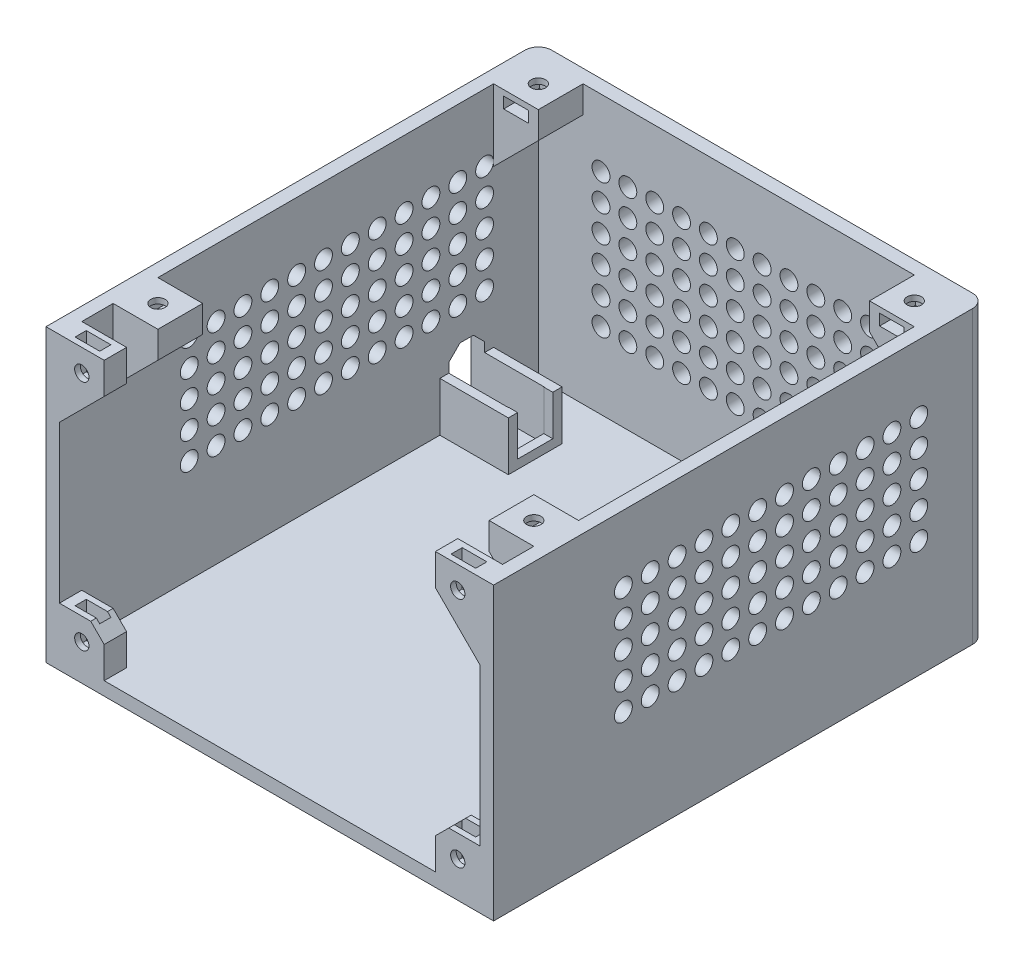
from build123d import *

# Parameters (mm, degrees)
SKETCH_2_W           = 100
SKETCH_2_H           = 65
EXTRUDE_1_DEPTH      = 110
SKETCH_3_W           = 94
SKETCH_3_H           = 107
CUT_EXTRUDE_1_DEPTH  = 62
SKETCH_4_W           = 10
SKETCH_4_H           = 10
SKETCH_4_R           = 1.6
EXTRUDE_2_DEPTH      = 5
SKETCH_5_W           = 10
SKETCH_5_H           = 10
SKETCH_5_R           = 1.6
EXTRUDE_3_DEPTH      = 5
SKETCH_6_W           = 5.5
SKETCH_6_H           = 2.5
CUT_EXTRUDE_2_DEPTH  = 8
SKETCH_8_W           = 5.5
SKETCH_8_H           = 2.5
CUT_EXTRUDE_3_DEPTH  = 8
CHAMFER_1_SIZE       = 3
CUT_EXTRUDE_5_REACH  = 154.172
EXTRUDE_5_DEPTH      = 11
SKETCH_16_W          = 5.817441426
SKETCH_16_H          = 7.857396668
CUT_EXTRUDE_6_DEPTH  = 9
SKETCH_31_W          = 10
SKETCH_31_H          = 6
EXTRUDE_10_DEPTH     = 10
EXTRUDE_10_2_DEPTH   = 10
EXTRUDE_14_DEPTH     = 10
EXTRUDE_16_DEPTH     = 10
SKETCH_32_R          = 1.6
CUT_EXTRUDE_15_DEPTH = 20
EXTRUDE_11_DEPTH     = 5
FILLET_8_R           = 3
FILLET_9_R           = 3
SKETCH_35_W          = 5.5
SKETCH_35_H          = 2.5
CUT_EXTRUDE_16_DEPTH = 8
SKETCH_36_W          = 10
SKETCH_36_H          = 6
EXTRUDE_12_DEPTH     = 10
SKETCH_37_W          = 10
SKETCH_37_H          = 6
EXTRUDE_13_DEPTH     = 10
EXTRUDE_15_DEPTH     = 10
EXTRUDE_17_DEPTH     = 10
SKETCH_38_R          = 1.6
CUT_EXTRUDE_17_DEPTH = 20
SKETCH_39_W          = 5.5
SKETCH_39_H          = 2.5
CUT_EXTRUDE_18_DEPTH = 8
SKETCH_46_R          = 2
CUT_EXTRUDE_31_DEPTH = 100
SKETCH_47_R          = 2
CUT_EXTRUDE_32_DEPTH = 6


with BuildPart() as part:
    # Эскиз2 → Бобышка-Вытянуть1 (new body)
    with BuildSketch(Plane.XY):
        Rectangle(SKETCH_2_W, SKETCH_2_H)
    extrude(amount=EXTRUDE_1_DEPTH)

    # Эскиз3 → Вырез-Вытянуть1 (cut)
    with BuildSketch(Plane(origin=(0, 32.5, 0), x_dir=(1, 0, 0), z_dir=(0, 1, 0))):
        with Locations((0, -56.5)):
            Rectangle(SKETCH_3_W, SKETCH_3_H)
    extrude(amount=-CUT_EXTRUDE_1_DEPTH, mode=Mode.SUBTRACT)

    # Эскиз4 → Бобышка-Вытянуть2 (add)
    # profile 1 of 2: a face of its own
    with BuildSketch(Plane.XY.offset(110)):
        with Locations((-42, -24.5)):
            Rectangle(SKETCH_4_W, SKETCH_4_H)
        with Locations((-42, -24.5)):
            Circle(SKETCH_4_R, mode=Mode.SUBTRACT)
    # profile 2 of 2: a face of its own
    with BuildSketch(Plane.XY.offset(110)):
        with Locations((42, -24.5)):
            Rectangle(SKETCH_4_W, SKETCH_4_H)
        with Locations((42, -24.5)):
            Circle(SKETCH_4_R, mode=Mode.SUBTRACT)
    extrude(amount=-EXTRUDE_2_DEPTH)

    # Эскиз5 → Бобышка-Вытянуть3 (add)
    # profile 1 of 2: a face of its own
    with BuildSketch(Plane.XY.offset(110)):
        with Locations((-42, 27.5)):
            Rectangle(SKETCH_5_W, SKETCH_5_H)
        with Locations((-42, 27.5)):
            Circle(SKETCH_5_R, mode=Mode.SUBTRACT)
    # profile 2 of 2: a face of its own
    with BuildSketch(Plane.XY.offset(110)):
        with Locations((42, 27.5)):
            Rectangle(SKETCH_5_W, SKETCH_5_H)
        with Locations((42, 27.5)):
            Circle(SKETCH_5_R, mode=Mode.SUBTRACT)
    extrude(amount=-EXTRUDE_3_DEPTH)

    # Эскиз6 → Вырез-Вытянуть2 (cut)
    with BuildSketch(Plane(origin=(0, 32.5, 0), x_dir=(1, 0, 0), z_dir=(0, 1, 0))):
        with Locations((-42, -107.5)):
            Rectangle(SKETCH_6_W, SKETCH_6_H)
        with Locations((42, -107.5)):
            Rectangle(SKETCH_6_W, SKETCH_6_H)
    extrude(amount=-CUT_EXTRUDE_2_DEPTH, mode=Mode.SUBTRACT)

    # Эскиз8 → Вырез-Вытянуть3 (cut)
    with BuildSketch(Plane(origin=(0, -19.5, 0), x_dir=(1, 0, 0), z_dir=(0, 1, 0))):
        with Locations((-42, -107.5)):
            Rectangle(SKETCH_8_W, SKETCH_8_H)
        with Locations((42, -107.5)):
            Rectangle(SKETCH_8_W, SKETCH_8_H)
    extrude(amount=-CUT_EXTRUDE_3_DEPTH, mode=Mode.SUBTRACT)

    # Фаска1
    # the kernel refuses this chamfer: 3 mm, written as the material it takes off along each edge
    with BuildSketch(Plane(origin=(-37, 22.5, 117.715048964), x_dir=(0.027495876610586733, 0.9996219169112968, 0), z_dir=(0, 0, -1)), Plane(origin=(-37, -19.5, 117.715048964), x_dir=(-0.9996219169112965, 0.02749587661058676, 0), z_dir=(0, 0, -1)), Plane(origin=(37, -19.5, 117.715048964), x_dir=(-0.027495876610586768, -0.9996219169112968, 0), z_dir=(0, 0, -1))) as chamfer_1_piece_1:
        Polygon((CHAMFER_1_SIZE * 0.999621916911, -CHAMFER_1_SIZE * 0.0274958766106), (-CHAMFER_1_SIZE * 0.0274958766106, -CHAMFER_1_SIZE * 0.999621916911), (0, 0), align=None)
    extrude(amount=20.430097928, mode=Mode.SUBTRACT)
    with BuildSketch(Plane(origin=(37, 22.5, 117.715048964), x_dir=(-0.027495876610586768, 0.9996219169112968, 0), z_dir=(0, 0, -1))) as chamfer_1_piece_2:
        Polygon((CHAMFER_1_SIZE * 0.999621916911, CHAMFER_1_SIZE * 0.0274958766106), (-CHAMFER_1_SIZE * 0.0274958766106, CHAMFER_1_SIZE * 0.999621916911), (0, 0), align=None)
    extrude(amount=20.430097928, mode=Mode.SUBTRACT)

    # Эскиз13 → Вырез-Вытянуть5 (cut, up to next)
    with BuildSketch(Plane.ZY.offset(50), mode=Mode.PRIVATE) as cut_extrude_5_sk1:
        Polygon((15, -29.5), (23, -29.5), (23, -16.4), (20.505788704, -13.9), (17.494211296, -13.9), (15, -16.4), align=None)
    cut_extrude_5_tool1 = extrude(cut_extrude_5_sk1.sketch, amount=-CUT_EXTRUDE_5_REACH, mode=Mode.PRIVATE) & part.part
    add(cut_extrude_5_tool1.solids().sort_by_distance((-50, -22.06639, 19))[0], mode=Mode.SUBTRACT)

    # Эскиз15 → Бобышка-Вытянуть5 (add)
    with BuildSketch(Plane(origin=(0, -29.5, 0), x_dir=(1, 0, 0), z_dir=(0, 1, 0))):
        Polygon((-47, -25), (-31.7, -25), (-31.7, -13), (-47, -13), (-47, -15), (-33.7, -15), (-33.7, -23), (-47, -23), align=None)
    extrude(amount=EXTRUDE_5_DEPTH)

    # Эскиз16 → Вырез-Вытянуть6 (cut)
    with BuildSketch(Plane(origin=(0, -18.5, 0), x_dir=(1, 0, 0), z_dir=(0, 1, 0))):
        with Locations((-31.7, -19)):
            Rectangle(SKETCH_16_W, SKETCH_16_H)
    extrude(amount=-CUT_EXTRUDE_6_DEPTH, mode=Mode.SUBTRACT)



with BuildPart() as body_2:
    # Эскиз31 → Бобышка-Вытянуть10 (new body)
    with BuildSketch(Plane.XY.offset(3)):
        with Locations((42, 29.5)):
            Rectangle(SKETCH_31_W, SKETCH_31_H)
    extrude(amount=EXTRUDE_10_DEPTH)


with BuildPart() as body_3:
    # Эскиз31 → Extrude 10 2 (new body)
    with BuildSketch(Plane.XY.offset(3)):
        with Locations((-42, 29.5)):
            Rectangle(SKETCH_31_W, SKETCH_31_H)
    extrude(amount=EXTRUDE_10_2_DEPTH)


with BuildPart() as part_1:
    add(part.part)

    add(body_2.part)  # Бобышка-Вытянуть14 merges body 2
    # Эскиз40 → Бобышка-Вытянуть14 (add)
    with BuildSketch(Plane.XY.offset(13)):
        Polygon((37, 26.5), (47, 26.5), (47, 16.5), align=None)
    extrude(amount=-EXTRUDE_14_DEPTH)


    add(body_3.part)  # Бобышка-Вытянуть16 merges body 3
    # Эскиз42 → Бобышка-Вытянуть16 (add)
    with BuildSketch(Plane.XY.offset(13)):
        Polygon((-37, 26.5), (-47, 26.5), (-47, 16.5), align=None)
    extrude(amount=-EXTRUDE_16_DEPTH)

    # Эскиз32 → Вырез-Вытянуть15 (cut)
    with BuildSketch(Plane(origin=(0, 32.5, 0), x_dir=(1, 0, 0), z_dir=(0, 1, 0))):
        with Locations(Location((-42, -8, 0), (0, 0, 270))):
            Circle(SKETCH_32_R)
        with Locations(Location((42, -8, 0), (0, 0, 270))):
            Circle(SKETCH_32_R)
    extrude(amount=-CUT_EXTRUDE_15_DEPTH, mode=Mode.SUBTRACT)

    # Эскиз34 → Бобышка-Вытянуть11 (add)
    with BuildSketch(Plane.XY.offset(110)):
        Polygon((-40, 22.5), (-47, 15.5), (-47, 22.5), align=None)
        Polygon((40, 22.5), (47, 22.5), (47, 15.5), align=None)
    extrude(amount=-EXTRUDE_11_DEPTH)

    # Скругление8
    fillet_8_edges = [part_1.edges().sort_by_distance(p)[0] for p in [
        (-50, 0, 0),
    ]]
    fillet(fillet_8_edges, radius=FILLET_8_R)

    # Скругление9
    fillet_9_edges = [part_1.edges().sort_by_distance(p)[0] for p in [
        (50, 0, 0),
    ]]
    fillet(fillet_9_edges, radius=FILLET_9_R)

    # Эскиз35 → Вырез-Вытянуть16 (cut)
    with BuildSketch(Plane.XY.offset(13)):
        with Locations((-42, 30)):
            Rectangle(SKETCH_35_W, SKETCH_35_H)
        with Locations((42, 30)):
            Rectangle(SKETCH_35_W, SKETCH_35_H)
    extrude(amount=-CUT_EXTRUDE_16_DEPTH, mode=Mode.SUBTRACT)

    # Эскиз36 → Бобышка-Вытянуть12 (add)
    with BuildSketch(Plane(origin=(-47, 0, 0), x_dir=(0, 0, -1), z_dir=(1, 0, 0))):
        with Locations((-93, 29.5)):
            Rectangle(SKETCH_36_W, SKETCH_36_H)
    extrude(amount=EXTRUDE_12_DEPTH)

    # Эскиз37 → Бобышка-Вытянуть13 (add)
    with BuildSketch(Plane.ZY.offset(-47)):
        with Locations((93, 29.5)):
            Rectangle(SKETCH_37_W, SKETCH_37_H)
    extrude(amount=EXTRUDE_13_DEPTH)

    # Эскиз41 → Бобышка-Вытянуть15 (add)
    with BuildSketch(Plane(origin=(0, 0, 88), x_dir=(-1, 0, 0), z_dir=(0, 0, -1))):
        Polygon((-47, 26.5), (-37, 26.5), (-47, 16.5), align=None)
    extrude(amount=-EXTRUDE_15_DEPTH)

    # Эскиз43 → Бобышка-Вытянуть17 (add)
    with BuildSketch(Plane(origin=(0, 0, 88), x_dir=(-1, 0, 0), z_dir=(0, 0, -1))):
        Polygon((37, 26.5), (47, 26.5), (47, 16.5), align=None)
    extrude(amount=-EXTRUDE_17_DEPTH)

    # Эскиз38 → Вырез-Вытянуть17 (cut)
    with BuildSketch(Plane(origin=(0, 32.5, 0), x_dir=(1, 0, 0), z_dir=(0, 1, 0))):
        with Locations(Location((-42, -93, 0), (0, 0, 270))):
            Circle(SKETCH_38_R)
        with Locations(Location((42, -93, 0), (0, 0, 270))):
            Circle(SKETCH_38_R)
    extrude(amount=-CUT_EXTRUDE_17_DEPTH, mode=Mode.SUBTRACT)

    # Эскиз39 → Вырез-Вытянуть18 (cut)
    with BuildSketch(Plane(origin=(0, 0, 88), x_dir=(-1, 0, 0), z_dir=(0, 0, -1))):
        with Locations((-42, 30)):
            Rectangle(SKETCH_39_W, SKETCH_39_H)
        with Locations((42, 30)):
            Rectangle(SKETCH_39_W, SKETCH_39_H)
    extrude(amount=-CUT_EXTRUDE_18_DEPTH, mode=Mode.SUBTRACT)

    # Эскиз46 → Вырез-Вытянуть31 (cut)
    with BuildSketch(Plane.ZY.offset(50)):
        with Locations(Location((15, 17.5, 0), (0, 0, 270))):
            Circle(SKETCH_46_R)
        with Locations(Location((21, 17.5, 0), (0, 0, 270))):
            Circle(SKETCH_46_R)
        with Locations(Location((27, 17.5, 0), (0, 0, 270))):
            Circle(SKETCH_46_R)
        with Locations(Location((33, 17.5, 0), (0, 0, 270))):
            Circle(SKETCH_46_R)
        with Locations(Location((39, 17.5, 0), (0, 0, 270))):
            Circle(SKETCH_46_R)
        with Locations(Location((45, 17.5, 0), (0, 0, 270))):
            Circle(SKETCH_46_R)
        with Locations(Location((51, 17.5, 0), (0, 0, 270))):
            Circle(SKETCH_46_R)
        with Locations(Location((57, 17.5, 0), (0, 0, 270))):
            Circle(SKETCH_46_R)
        with Locations(Location((63, 17.5, 0), (0, 0, 270))):
            Circle(SKETCH_46_R)
        with Locations(Location((69, 17.5, 0), (0, 0, 270))):
            Circle(SKETCH_46_R)
        with Locations(Location((75, 17.5, 0), (0, 0, 270))):
            Circle(SKETCH_46_R)
        with Locations(Location((81, 17.5, 0), (0, 0, 270))):
            Circle(SKETCH_46_R)
        with Locations(Location((21, 11.5, 0), (0, 0, 270))):
            Circle(SKETCH_46_R)
        with Locations(Location((27, 11.5, 0), (0, 0, 270))):
            Circle(SKETCH_46_R)
        with Locations(Location((33, 11.5, 0), (0, 0, 270))):
            Circle(SKETCH_46_R)
        with Locations(Location((39, 11.5, 0), (0, 0, 270))):
            Circle(SKETCH_46_R)
        with Locations(Location((45, 11.5, 0), (0, 0, 270))):
            Circle(SKETCH_46_R)
        with Locations(Location((51, 11.5, 0), (0, 0, 270))):
            Circle(SKETCH_46_R)
        with Locations(Location((57, 11.5, 0), (0, 0, 270))):
            Circle(SKETCH_46_R)
        with Locations(Location((63, 11.5, 0), (0, 0, 270))):
            Circle(SKETCH_46_R)
        with Locations(Location((69, 11.5, 0), (0, 0, 270))):
            Circle(SKETCH_46_R)
        with Locations(Location((75, 11.5, 0), (0, 0, 270))):
            Circle(SKETCH_46_R)
        with Locations(Location((81, 11.5, 0), (0, 0, 270))):
            Circle(SKETCH_46_R)
        with Locations(Location((15, 11.5, 0), (0, 0, 270))):
            Circle(SKETCH_46_R)
        with Locations(Location((15, 5.5, 0), (0, 0, 270))):
            Circle(SKETCH_46_R)
        with Locations(Location((21, 5.5, 0), (0, 0, 270))):
            Circle(SKETCH_46_R)
        with Locations(Location((27, 5.5, 0), (0, 0, 270))):
            Circle(SKETCH_46_R)
        with Locations(Location((33, 5.5, 0), (0, 0, 270))):
            Circle(SKETCH_46_R)
        with Locations(Location((39, 5.5, 0), (0, 0, 270))):
            Circle(SKETCH_46_R)
        with Locations(Location((45, 5.5, 0), (0, 0, 270))):
            Circle(SKETCH_46_R)
        with Locations(Location((51, 5.5, 0), (0, 0, 270))):
            Circle(SKETCH_46_R)
        with Locations(Location((57, 5.5, 0), (0, 0, 270))):
            Circle(SKETCH_46_R)
        with Locations(Location((63, 5.5, 0), (0, 0, 270))):
            Circle(SKETCH_46_R)
        with Locations(Location((69, 5.5, 0), (0, 0, 270))):
            Circle(SKETCH_46_R)
        with Locations(Location((75, 5.5, 0), (0, 0, 270))):
            Circle(SKETCH_46_R)
        with Locations(Location((81, 5.5, 0), (0, 0, 270))):
            Circle(SKETCH_46_R)
        with Locations(Location((15, -0.5, 0), (0, 0, 270))):
            Circle(SKETCH_46_R)
        with Locations(Location((21, -0.5, 0), (0, 0, 270))):
            Circle(SKETCH_46_R)
        with Locations(Location((27, -0.5, 0), (0, 0, 270))):
            Circle(SKETCH_46_R)
        with Locations(Location((33, -0.5, 0), (0, 0, 270))):
            Circle(SKETCH_46_R)
        with Locations(Location((39, -0.5, 0), (0, 0, 270))):
            Circle(SKETCH_46_R)
        with Locations(Location((45, -0.5, 0), (0, 0, 270))):
            Circle(SKETCH_46_R)
        with Locations(Location((51, -0.5, 0), (0, 0, 270))):
            Circle(SKETCH_46_R)
        with Locations(Location((57, -0.5, 0), (0, 0, 270))):
            Circle(SKETCH_46_R)
        with Locations(Location((63, -0.5, 0), (0, 0, 270))):
            Circle(SKETCH_46_R)
        with Locations(Location((69, -0.5, 0), (0, 0, 270))):
            Circle(SKETCH_46_R)
        with Locations(Location((75, -0.5, 0), (0, 0, 270))):
            Circle(SKETCH_46_R)
        with Locations(Location((81, -0.5, 0), (0, 0, 270))):
            Circle(SKETCH_46_R)
        with Locations(Location((15, -6.5, 0), (0, 0, 270))):
            Circle(SKETCH_46_R)
        with Locations(Location((21, -6.5, 0), (0, 0, 270))):
            Circle(SKETCH_46_R)
        with Locations(Location((27, -6.5, 0), (0, 0, 270))):
            Circle(SKETCH_46_R)
        with Locations(Location((33, -6.5, 0), (0, 0, 270))):
            Circle(SKETCH_46_R)
        with Locations(Location((39, -6.5, 0), (0, 0, 270))):
            Circle(SKETCH_46_R)
        with Locations(Location((45, -6.5, 0), (0, 0, 270))):
            Circle(SKETCH_46_R)
        with Locations(Location((51, -6.5, 0), (0, 0, 270))):
            Circle(SKETCH_46_R)
        with Locations(Location((57, -6.5, 0), (0, 0, 270))):
            Circle(SKETCH_46_R)
        with Locations(Location((63, -6.5, 0), (0, 0, 270))):
            Circle(SKETCH_46_R)
        with Locations(Location((69, -6.5, 0), (0, 0, 270))):
            Circle(SKETCH_46_R)
        with Locations(Location((75, -6.5, 0), (0, 0, 270))):
            Circle(SKETCH_46_R)
        with Locations(Location((81, -6.5, 0), (0, 0, 270))):
            Circle(SKETCH_46_R)
    extrude(amount=-CUT_EXTRUDE_31_DEPTH, mode=Mode.SUBTRACT)

    # Эскиз47 → Вырез-Вытянуть32 (cut)
    with BuildSketch(Plane(origin=(0, 0, 0), x_dir=(-1, 0, 0), z_dir=(0, 0, -1))):
        with Locations((-33, 17.5)):
            Circle(SKETCH_47_R)
        with Locations((-27, 17.5)):
            Circle(SKETCH_47_R)
        with Locations((-21, 17.5)):
            Circle(SKETCH_47_R)
        with Locations((-15, 17.5)):
            Circle(SKETCH_47_R)
        with Locations((-9, 17.5)):
            Circle(SKETCH_47_R)
        with Locations((-3, 17.5)):
            Circle(SKETCH_47_R)
        with Locations((3, 17.5)):
            Circle(SKETCH_47_R)
        with Locations((9, 17.5)):
            Circle(SKETCH_47_R)
        with Locations((15, 17.5)):
            Circle(SKETCH_47_R)
        with Locations((21, 17.5)):
            Circle(SKETCH_47_R)
        with Locations((27, 17.5)):
            Circle(SKETCH_47_R)
        with Locations((33, 17.5)):
            Circle(SKETCH_47_R)
        with Locations((-27, 11.5)):
            Circle(SKETCH_47_R)
        with Locations((-21, 11.5)):
            Circle(SKETCH_47_R)
        with Locations((-15, 11.5)):
            Circle(SKETCH_47_R)
        with Locations((-9, 11.5)):
            Circle(SKETCH_47_R)
        with Locations((-3, 11.5)):
            Circle(SKETCH_47_R)
        with Locations((3, 11.5)):
            Circle(SKETCH_47_R)
        with Locations((9, 11.5)):
            Circle(SKETCH_47_R)
        with Locations((15, 11.5)):
            Circle(SKETCH_47_R)
        with Locations((21, 11.5)):
            Circle(SKETCH_47_R)
        with Locations((27, 11.5)):
            Circle(SKETCH_47_R)
        with Locations((33, 11.5)):
            Circle(SKETCH_47_R)
        with Locations((-27, 5.5)):
            Circle(SKETCH_47_R)
        with Locations((-21, 5.5)):
            Circle(SKETCH_47_R)
        with Locations((-15, 5.5)):
            Circle(SKETCH_47_R)
        with Locations((-9, 5.5)):
            Circle(SKETCH_47_R)
        with Locations((-3, 5.5)):
            Circle(SKETCH_47_R)
        with Locations((3, 5.5)):
            Circle(SKETCH_47_R)
        with Locations((9, 5.5)):
            Circle(SKETCH_47_R)
        with Locations((15, 5.5)):
            Circle(SKETCH_47_R)
        with Locations((21, 5.5)):
            Circle(SKETCH_47_R)
        with Locations((27, 5.5)):
            Circle(SKETCH_47_R)
        with Locations((33, 5.5)):
            Circle(SKETCH_47_R)
        with Locations((-27, -0.5)):
            Circle(SKETCH_47_R)
        with Locations((-21, -0.5)):
            Circle(SKETCH_47_R)
        with Locations((-15, -0.5)):
            Circle(SKETCH_47_R)
        with Locations((-9, -0.5)):
            Circle(SKETCH_47_R)
        with Locations((-3, -0.5)):
            Circle(SKETCH_47_R)
        with Locations((3, -0.5)):
            Circle(SKETCH_47_R)
        with Locations((9, -0.5)):
            Circle(SKETCH_47_R)
        with Locations((15, -0.5)):
            Circle(SKETCH_47_R)
        with Locations((21, -0.5)):
            Circle(SKETCH_47_R)
        with Locations((27, -0.5)):
            Circle(SKETCH_47_R)
        with Locations((33, -0.5)):
            Circle(SKETCH_47_R)
        with Locations((-27, -6.5)):
            Circle(SKETCH_47_R)
        with Locations((-21, -6.5)):
            Circle(SKETCH_47_R)
        with Locations((-15, -6.5)):
            Circle(SKETCH_47_R)
        with Locations((-9, -6.5)):
            Circle(SKETCH_47_R)
        with Locations((-3, -6.5)):
            Circle(SKETCH_47_R)
        with Locations((3, -6.5)):
            Circle(SKETCH_47_R)
        with Locations((9, -6.5)):
            Circle(SKETCH_47_R)
        with Locations((15, -6.5)):
            Circle(SKETCH_47_R)
        with Locations((21, -6.5)):
            Circle(SKETCH_47_R)
        with Locations((27, -6.5)):
            Circle(SKETCH_47_R)
        with Locations((33, -6.5)):
            Circle(SKETCH_47_R)
        with Locations((-27, -12.5)):
            Circle(SKETCH_47_R)
        with Locations((-21, -12.5)):
            Circle(SKETCH_47_R)
        with Locations((-15, -12.5)):
            Circle(SKETCH_47_R)
        with Locations((-9, -12.5)):
            Circle(SKETCH_47_R)
        with Locations((-3, -12.5)):
            Circle(SKETCH_47_R)
        with Locations((3, -12.5)):
            Circle(SKETCH_47_R)
        with Locations((9, -12.5)):
            Circle(SKETCH_47_R)
        with Locations((15, -12.5)):
            Circle(SKETCH_47_R)
        with Locations((21, -12.5)):
            Circle(SKETCH_47_R)
        with Locations((27, -12.5)):
            Circle(SKETCH_47_R)
        with Locations((33, -12.5)):
            Circle(SKETCH_47_R)
        with Locations((-33, 11.5)):
            Circle(SKETCH_47_R)
        with Locations((-33, 5.5)):
            Circle(SKETCH_47_R)
        with Locations((-33, -0.5)):
            Circle(SKETCH_47_R)
        with Locations((-33, -6.5)):
            Circle(SKETCH_47_R)
        with Locations((-33, -12.5)):
            Circle(SKETCH_47_R)
    extrude(amount=-CUT_EXTRUDE_32_DEPTH, mode=Mode.SUBTRACT)


solid = part_1.part
